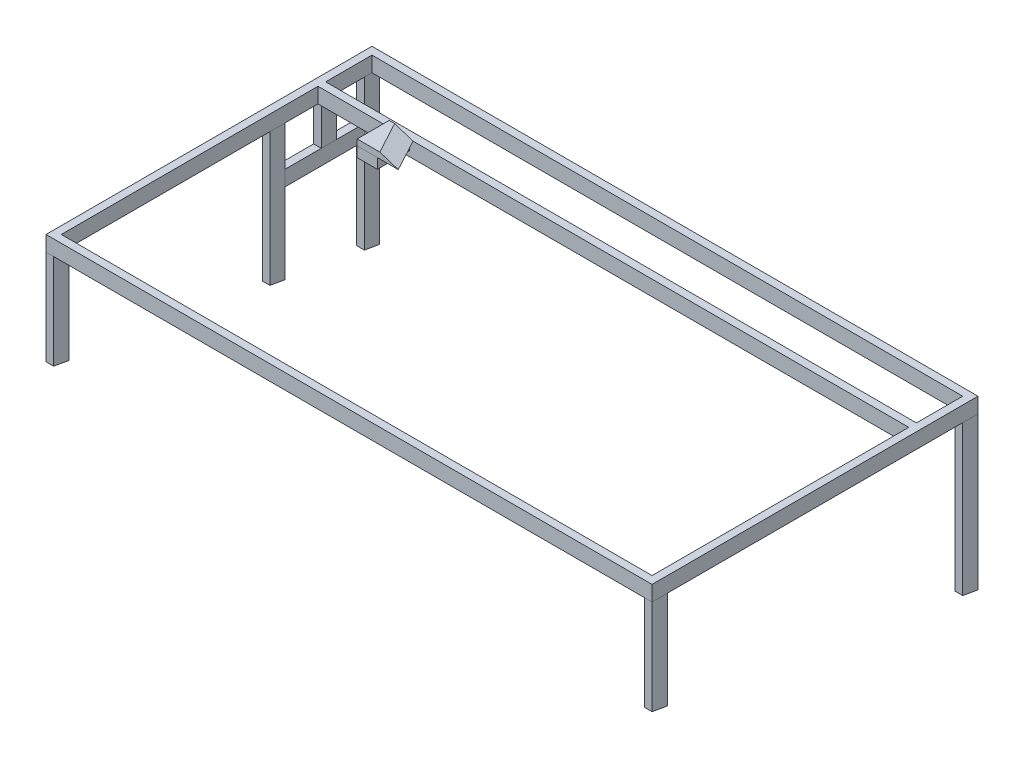
from build123d import *

# Parameters (mm, degrees)
SKETCH22_W          = 1511.3
SKETCH22_H          = 812.8
SKETCH22_W_2        = 1473.2
SKETCH22_H_2        = 774.7
BOSS_EXTRUDE3_DEPTH = 38.1
BOSS_EXTRUDE4_REACH = 860.848
SKETCH23_W          = 19.05
SKETCH23_H          = 38.1
BOSS_EXTRUDE5_REACH = 893.918
SKETCH24_W          = 19.05
SKETCH24_H          = 38.1
SKETCH26_W          = 1473.2
SKETCH26_H          = 19.05
BOSS_EXTRUDE6_DEPTH = 38.1
SKETCH27_W          = 19.05
SKETCH27_H          = 38.1
BOSS_EXTRUDE7_DEPTH = 197.32
SKETCH29_W          = 19.05
SKETCH29_H          = 38.1
BOSS_EXTRUDE8_DEPTH = 100
SKETCH30_W          = 50.4
SKETCH30_H          = 25.4
BOSS_EXTRUDE9_DEPTH = 80


with BuildPart() as part:
    # Sketch22 → Boss-Extrude3 (new body)
    with BuildSketch(Plane(origin=(0, 0, 0), x_dir=(1, 0, 0), z_dir=(0, 1, 0))):
        Rectangle(SKETCH22_W, SKETCH22_H)
        Rectangle(SKETCH22_W_2, SKETCH22_H_2, mode=Mode.SUBTRACT)
    extrude(amount=-BOSS_EXTRUDE3_DEPTH)

    # Sketch26 → Boss-Extrude6 (add)
    with BuildSketch(Plane(origin=(0, 0, 0), x_dir=(1, 0, 0), z_dir=(0, 1, 0))):
        with Locations((0, 262.375)):
            Rectangle(SKETCH26_W, SKETCH26_H)
    extrude(amount=-BOSS_EXTRUDE6_DEPTH)


with BuildPart() as body_2:
    # Boss-Extrude4: up to this plane
    boss_extrude4_end = Plane(origin=(0, -336.206228482, 59.282229164), z_dir=(0, 0.984807753012208, -0.17364817766693072))
    # Sketch23 → Boss-Extrude4 (new, up to the surface)
    with BuildSketch(Plane.XZ.offset(38.1), mode=Mode.PRIVATE) as boss_extrude4_sk1:
        with Locations((-746.125, 387.35)):
            Rectangle(SKETCH23_W, SKETCH23_H)
    boss_extrude4_tool1 = split(extrude(boss_extrude4_sk1.sketch, amount=BOSS_EXTRUDE4_REACH, mode=Mode.PRIVATE), bisect_by=boss_extrude4_end, keep=Keep.BOTH, mode=Mode.PRIVATE)
    add(boss_extrude4_tool1.solids().sort_by_distance((-746.125, -38.1, 387.35))[0])
    # Sketch23 → Boss-Extrude4 (new, up to the surface)
    with BuildSketch(Plane.XZ.offset(38.1), mode=Mode.PRIVATE) as boss_extrude4_sk2:
        with Locations((746.125, 387.35)):
            Rectangle(SKETCH23_W, SKETCH23_H)
    boss_extrude4_tool2 = split(extrude(boss_extrude4_sk2.sketch, amount=BOSS_EXTRUDE4_REACH, mode=Mode.PRIVATE), bisect_by=boss_extrude4_end, keep=Keep.BOTH, mode=Mode.PRIVATE)
    add(boss_extrude4_tool2.solids().sort_by_distance((746.125, -38.1, 387.35))[0])


with BuildPart() as body_3:
    # Boss-Extrude5: up to this plane
    boss_extrude5_end = Plane(origin=(0, -336.206228482, 59.282229164), z_dir=(0, 0.984807753012208, -0.17364817766693072))
    # Sketch24 → Boss-Extrude5 (new, up to the surface)
    with BuildSketch(Plane.XZ.offset(38.1), mode=Mode.PRIVATE) as boss_extrude5_sk1:
        with Locations((-746.125, -387.35)):
            Rectangle(SKETCH24_W, SKETCH24_H)
    boss_extrude5_tool1 = split(extrude(boss_extrude5_sk1.sketch, amount=BOSS_EXTRUDE5_REACH, mode=Mode.PRIVATE), bisect_by=boss_extrude5_end, keep=Keep.BOTH, mode=Mode.PRIVATE)
    add(boss_extrude5_tool1.solids().sort_by_distance((-746.125, -38.1, -387.35))[0])
    # Sketch24 → Boss-Extrude5 (new, up to the surface)
    with BuildSketch(Plane.XZ.offset(38.1), mode=Mode.PRIVATE) as boss_extrude5_sk2:
        with Locations((746.125, -387.35)):
            Rectangle(SKETCH24_W, SKETCH24_H)
    boss_extrude5_tool2 = split(extrude(boss_extrude5_sk2.sketch, amount=BOSS_EXTRUDE5_REACH, mode=Mode.PRIVATE), bisect_by=boss_extrude5_end, keep=Keep.BOTH, mode=Mode.PRIVATE)
    add(boss_extrude5_tool2.solids().sort_by_distance((746.125, -38.1, -387.35))[0])
    # Sketch24 → Boss-Extrude5 (new, up to the surface)
    with BuildSketch(Plane.XZ.offset(38.1), mode=Mode.PRIVATE) as boss_extrude5_sk3:
        with Locations((-746.125, -151.93)):
            Rectangle(SKETCH24_W, SKETCH24_H)
    boss_extrude5_tool3 = split(extrude(boss_extrude5_sk3.sketch, amount=BOSS_EXTRUDE5_REACH, mode=Mode.PRIVATE), bisect_by=boss_extrude5_end, keep=Keep.BOTH, mode=Mode.PRIVATE)
    add(boss_extrude5_tool3.solids().sort_by_distance((-746.125, -38.1, -151.93))[0])


with BuildPart() as body_4:
    # Sketch27 → Boss-Extrude7 (new body)
    with BuildSketch(Plane(origin=(0, 0, -170.98), x_dir=(-1, 0, 0), z_dir=(0, 0, -1))):
        with Locations((746.125, -157.15)):
            Rectangle(SKETCH27_W, SKETCH27_H)
    extrude(amount=BOSS_EXTRUDE7_DEPTH)


with BuildPart() as body_5:
    # Sketch29 → Boss-Extrude8 (new body)
    with BuildSketch(Plane.XZ.offset(38.1)):
        with Locations((-746.125, -280.03)):
            Rectangle(SKETCH29_W, SKETCH29_H)
    extrude(amount=BOSS_EXTRUDE8_DEPTH)


with BuildPart() as body_6:
    # Sketch30 → Boss-Extrude9 (new body)
    with BuildSketch(Plane.XY.offset(-252.85)):
        with Locations((-533.8, -12.7)):
            Rectangle(SKETCH30_W, SKETCH30_H)
    extrude(amount=BOSS_EXTRUDE9_DEPTH)


with BuildPart() as body_7:
    # Boss-Extrude11: read off the stored shape, not the designer's step
    # Boss-Extrude11: loft between two sections, ruled curve by curve
    boss_extrude11_from = [
        Edge.make_line((-499.623008206, 0, -252.85), (-559, 0, -252.85)),
        Edge.make_line((-545.516767314, 15, -252.85), (-559, 15, -252.85)),
        Edge.make_line((-559, 15, -252.85), (-559, 0, -252.85)),
        Edge.make_line((-499.623008206, 0, -252.85), (-545.516767314, 15, -252.85)),
    ]
    boss_extrude11_to = [
        Edge.make_line((-456.46403233, 0, -172.85), (-559, 0, -172.85)),
        Edge.make_line((-502.357791437, 15, -172.85), (-559, 15, -172.85)),
        Edge.make_line((-559, 15, -172.85), (-559, 0, -172.85)),
        Edge.make_line((-456.46403233, 0, -172.85), (-502.357791437, 15, -172.85)),
    ]
    boss_extrude11 = Solid(Shell([*[Face.make_surface_from_curves(boss_extrude11_from[k], boss_extrude11_to[k]) for k in range(4)], Face(Wire(boss_extrude11_from)), Face(Wire(boss_extrude11_to))]))
    add(boss_extrude11)


solid = Compound([part.part, body_2.part, body_3.part, body_4.part, body_5.part, body_6.part, body_7.part])
